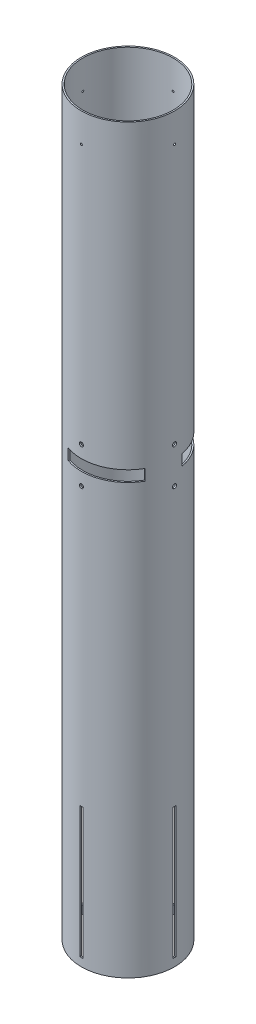
from build123d import *

# Parameters (mm, degrees)
SKETCH1_R              = 51.1048
SKETCH1_R_2            = 49.53
BOSS_EXTRUDE1_DEPTH    = 812.8
CUT_EXTRUDE1_DEPTH     = 817.00688794
CIRPATTERN1_COUNT      = 4
CUT_EXTRUDE2_DEPTH     = 817.00688794
CIRPATTERN2_COUNT      = 4
SKETCH3_R              = 3.175
CUT_EXTRUDE3_DEPTH     = 817.006888054
CUT_EXTRUDE4_START     = 470.535
CUT_EXTRUDE4_DEPTH     = 12.065
CIRPATTERN3_COUNT      = 3
LPATTERN1_COPY_1_DEPTH = 817.00688794
LPATTERN1_COPY_2_DEPTH = 817.00688794
LPATTERN1_COPY_3_DEPTH = 817.00688794
LPATTERN1_COPY_4_DEPTH = 817.00688794
SKETCH8_R              = 1.0922
CUT_EXTRUDE5_DEPTH     = 817.006888054
CIRPATTERN4_COUNT      = 4
SKETCH18_W             = 6.54812
SKETCH18_H             = 51.1048


with BuildPart() as part:
    # Sketch1 → Boss-Extrude1 (new body)
    with BuildSketch(Plane(origin=(0, 0, 0), x_dir=(1, 0, 0), z_dir=(0, 1, 0))):
        Circle(SKETCH1_R)
        Circle(SKETCH1_R_2, mode=Mode.SUBTRACT)
    extrude(amount=BOSS_EXTRUDE1_DEPTH)

    # Sketch2 → Cut-Extrude1 (cut, through all)
    with BuildSketch(Plane(origin=(0, 0, 0), x_dir=(0, 0, -1), z_dir=(1, 0, 0))):
        Polygon((0, 8.89), (1.5875, 8.89), (1.5875, 152.4), (-1.5875, 152.4), (-1.5875, 8.89), align=None)
    cut_extrude1 = extrude(amount=-CUT_EXTRUDE1_DEPTH, mode=Mode.SUBTRACT)

    # CirPattern1: Cut-Extrude1 ×4 about axis
    cirpattern1_axis = Axis((0, 0, 0), (0, 1, 0))
    for i in range(1, CIRPATTERN1_COUNT):
        add(cut_extrude1.rotate(cirpattern1_axis, i * 360 / CIRPATTERN1_COUNT), mode=Mode.SUBTRACT)

    # Sketch2<3> → Cut-Extrude2 (cut, through all)
    with BuildSketch(Plane(origin=(0, 0, 0), x_dir=(0, 0, -1), z_dir=(1, 0, 0))):
        with BuildLine():
            ThreePointArc((0, 498.438004265), (-1.590990219, 494.597014101), (2.249999945, 496.18800432))
            ThreePointArc((2.249999945, 496.18800432), (1.590990219, 497.778994539), (0, 498.438004265))
        make_face()
    cut_extrude2 = extrude(amount=-CUT_EXTRUDE2_DEPTH, mode=Mode.SUBTRACT)

    # CirPattern2: Cut-Extrude2 ×4 about axis
    cirpattern2_axis = Axis((0, 812.8, 0), (0, -1, 0))
    for i in range(1, CIRPATTERN2_COUNT):
        add(cut_extrude2.rotate(cirpattern2_axis, i * 360 / CIRPATTERN2_COUNT), mode=Mode.SUBTRACT)

    # Sketch3 → Cut-Extrude3 (cut, through all)
    with BuildSketch(Plane(origin=(0, 0, 0), x_dir=(0.7071067811865477, 0, -0.7071067811865475), z_dir=(0.7071067811865475, 0, 0.7071067811865477))):
        with Locations((0, 127)):
            Circle(SKETCH3_R)
    extrude(amount=-CUT_EXTRUDE3_DEPTH, mode=Mode.SUBTRACT)

    # Sketch7 → Cut-Extrude4 (cut)
    with BuildSketch(Plane(origin=(0, 0, 0), x_dir=(1, 0, 0), z_dir=(0, 1, 0)).offset(CUT_EXTRUDE4_START)):
        with BuildLine():
            Line((-44.258055055, -25.5524), (-42.894238249, -24.765))
            ThreePointArc((-42.894238249, -24.765), (-48.777528007, 8.60079424), (-31.837270308, 37.942181268))
            Line((-31.837270308, 37.942181268), (-32.849532236, 39.148548057))
            ThreePointArc((-32.849532236, 39.148548057), (-45.829888074, 22.612428931), (-51.055245404, 2.249999945))
            ThreePointArc((-51.055245404, 2.249999945), (-51.1048, 0), (-51.055245404, -2.249999945))
            ThreePointArc((-51.055245404, -2.249999945), (-49.060236172, -14.310618779), (-44.258055055, -25.5524))
        make_face()
    cut_extrude4 = extrude(amount=CUT_EXTRUDE4_DEPTH, mode=Mode.SUBTRACT)

    # CirPattern3: Cut-Extrude4 ×3 about axis
    cirpattern3_axis = Axis((0, 812.8, 0), (0, -1, 0))
    for i in range(1, CIRPATTERN3_COUNT):
        add(cut_extrude4.rotate(cirpattern3_axis, i * 360 / CIRPATTERN3_COUNT), mode=Mode.SUBTRACT)

    # LPattern1 copy 1 sketch → LPattern1 copy 1 (cut, through all)
    with BuildSketch(Plane(origin=(0, -39.69160972, 0), x_dir=(1, 0, 0), z_dir=(0, 0, 1))):
        with BuildLine():
            ThreePointArc((0, 498.438004265), (-1.590990219, 494.597014101), (2.249999945, 496.18800432))
            ThreePointArc((2.249999945, 496.18800432), (1.590990219, 497.778994539), (0, 498.438004265))
        make_face()
    extrude(amount=-LPATTERN1_COPY_1_DEPTH, mode=Mode.SUBTRACT)

    # LPattern1 copy 2 sketch → LPattern1 copy 2 (cut, through all)
    with BuildSketch(Plane(origin=(0, -39.69160972, 0), x_dir=(0, 0, 1), z_dir=(-1, 0, 0))):
        with BuildLine():
            ThreePointArc((0, 498.438004265), (-1.590990219, 494.597014101), (2.249999945, 496.18800432))
            ThreePointArc((2.249999945, 496.18800432), (1.590990219, 497.778994539), (0, 498.438004265))
        make_face()
    extrude(amount=-LPATTERN1_COPY_2_DEPTH, mode=Mode.SUBTRACT)

    # LPattern1 copy 3 sketch → LPattern1 copy 3 (cut, through all)
    with BuildSketch(Plane(origin=(0, -39.69160972, 0), x_dir=(-1, 0, 0), z_dir=(0, 0, -1))):
        with BuildLine():
            ThreePointArc((0, 498.438004265), (-1.590990219, 494.597014101), (2.249999945, 496.18800432))
            ThreePointArc((2.249999945, 496.18800432), (1.590990219, 497.778994539), (0, 498.438004265))
        make_face()
    extrude(amount=-LPATTERN1_COPY_3_DEPTH, mode=Mode.SUBTRACT)

    # LPattern1 copy 4 sketch → LPattern1 copy 4 (cut, through all)
    with BuildSketch(Plane(origin=(0, -39.69160972, 0), x_dir=(0, 0, -1), z_dir=(1, 0, 0))):
        with BuildLine():
            ThreePointArc((0, 498.438004265), (-1.590990219, 494.597014101), (2.249999945, 496.18800432))
            ThreePointArc((2.249999945, 496.18800432), (1.590990219, 497.778994539), (0, 498.438004265))
        make_face()
    extrude(amount=-LPATTERN1_COPY_4_DEPTH, mode=Mode.SUBTRACT)

    # Sketch8 → Cut-Extrude5 (cut, through all)
    with BuildSketch(Plane.XY):
        with Locations((0, 781.05)):
            Circle(SKETCH8_R)
    cut_extrude5 = extrude(amount=-CUT_EXTRUDE5_DEPTH, mode=Mode.SUBTRACT)

    # CirPattern4: Cut-Extrude5 ×4 about axis
    cirpattern4_axis = Axis((0, 812.8, 0), (0, -1, 0))
    for i in range(1, CIRPATTERN4_COUNT):
        add(cut_extrude5.rotate(cirpattern4_axis, i * 360 / CIRPATTERN4_COUNT), mode=Mode.SUBTRACT)

    # Sketch18 → 1/2 Clearance Hole4 (revolve, cut)
    with BuildSketch(Plane(origin=(0, 752.856, 0), x_dir=(0, -1, 0), z_dir=(1, 0, 0))):
        with Locations((3.27406, 25.5524)):
            Rectangle(SKETCH18_W, SKETCH18_H)
    revolve(axis=Axis((0, 752.856, 6.35), (0, 0, -1)), mode=Mode.SUBTRACT)


solid = part.part
